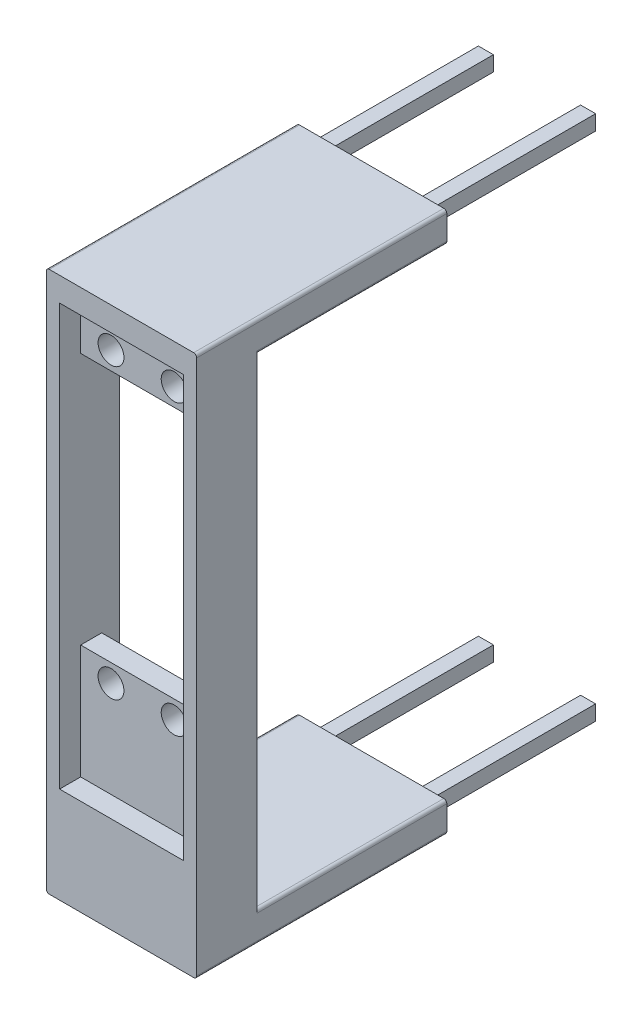
from build123d import *

# Parameters (mm, degrees)
BOSS_EXTRUDE1_OUTLINE_W   = 25
BOSS_EXTRUDE1_OUTLINE_H   = 5
BOSS_EXTRUDE1_OUTLINE_W_2 = 3
BOSS_EXTRUDE1_OUTLINE_H_2 = 3
BOSS_EXTRUDE1_DEPTH       = 31.595565731
SKETCH4_W                 = 25
SKETCH4_H                 = 90
BOSS_EXTRUDE3_DEPTH       = 10
SKETCH6_R                 = 2.15
CUT_EXTRUDE2_DEPTH        = 10
SKETCH7_W                 = 20.6
SKETCH7_H                 = 42
CUT_EXTRUDE3_DEPTH        = 10
SKETCH9_W                 = 2
SKETCH9_H                 = 90
CUT_EXTRUDE4_DEPTH        = 105.890618955
SKETCH10_W                = 2
SKETCH10_H                = 90
BOSS_EXTRUDE4_DEPTH       = 25
SKETCH8_W                 = 2.5
SKETCH8_H                 = 2.5
BOSS_EXTRUDE5_DEPTH       = 27.5
SKETCH11_W                = 3
SKETCH11_H                = 80
CUT_EXTRUDE5_DEPTH        = 123.742049491
SKETCH13_W                = 20.6
SKETCH13_H                = 57
CUT_EXTRUDE6_DEPTH        = 3
FILLET1_R                 = 0.5
SKETCH14_W                = 20.6
SKETCH14_H                = 70
CUT_EXTRUDE7_DEPTH        = 3.5


# Read off the part's stored shape, not the designer's step: Boss-Extrude1
with BuildPart() as part:
    # Boss-Extrude1 outline → Boss-Extrude1 (new body)
    # profile 1 of 2: a face of its own
    with BuildSketch(Plane.XY.offset(-60.133068515)):
        with Locations((125.570893714, 79.725640866)):
            Rectangle(BOSS_EXTRUDE1_OUTLINE_W, BOSS_EXTRUDE1_OUTLINE_H)
        with Locations((117.070893714, 79.725640866)):
            Rectangle(BOSS_EXTRUDE1_OUTLINE_W_2, BOSS_EXTRUDE1_OUTLINE_H_2, mode=Mode.SUBTRACT)
        with Locations((134.070893714, 79.725640866)):
            Rectangle(BOSS_EXTRUDE1_OUTLINE_W_2, BOSS_EXTRUDE1_OUTLINE_H_2, mode=Mode.SUBTRACT)
    # profile 2 of 2: a face of its own
    with BuildSketch(Plane.XY.offset(-60.133068515)):
        with Locations((125.570893714, -5.274359134)):
            Rectangle(BOSS_EXTRUDE1_OUTLINE_W, BOSS_EXTRUDE1_OUTLINE_H)
        with Locations((117.070893714, -5.274359134)):
            Rectangle(BOSS_EXTRUDE1_OUTLINE_W_2, BOSS_EXTRUDE1_OUTLINE_H_2, mode=Mode.SUBTRACT)
        with Locations((134.070893714, -5.274359134)):
            Rectangle(BOSS_EXTRUDE1_OUTLINE_W_2, BOSS_EXTRUDE1_OUTLINE_H_2, mode=Mode.SUBTRACT)
    extrude(amount=BOSS_EXTRUDE1_DEPTH)

    # Sketch4 → Boss-Extrude3 (add)
    with BuildSketch(Plane.XY.offset(-28.537502783)):
        with Locations((125.570893714, 37.225640866)):
            Rectangle(SKETCH4_W, SKETCH4_H)
    extrude(amount=BOSS_EXTRUDE3_DEPTH)

    # Sketch6 → Cut-Extrude2 (cut)
    with BuildSketch(Plane.XY.offset(-18.537502783)):
        with Locations((130.820893714, 24.225640866)):
            Circle(SKETCH6_R)
        with Locations((120.320893714, 24.225640866)):
            Circle(SKETCH6_R)
        with Locations((130.820893714, 72.225640866)):
            Circle(SKETCH6_R)
        with Locations((120.320893714, 72.225640866)):
            Circle(SKETCH6_R)
        with Locations((130.820893714, 72.225640866)):
            Circle(SKETCH6_R)
    extrude(amount=-CUT_EXTRUDE2_DEPTH, mode=Mode.SUBTRACT)

    # Sketch7 → Cut-Extrude3 (cut)
    with BuildSketch(Plane.XY.offset(-18.537502783)):
        with Locations((125.570893714, 48.225640866)):
            Rectangle(SKETCH7_W, SKETCH7_H)
    extrude(amount=-CUT_EXTRUDE3_DEPTH, mode=Mode.SUBTRACT)

    # Sketch9 → Cut-Extrude4 (cut, through all)
    with BuildSketch(Plane(origin=(138.070893714, 0, 0), x_dir=(0, 0, -1), z_dir=(1, 0, 0))):
        with Locations((59.133068515, 37.225640866)):
            Rectangle(SKETCH9_W, SKETCH9_H)
    extrude(amount=-CUT_EXTRUDE4_DEPTH, mode=Mode.SUBTRACT)

    # Sketch10 → Boss-Extrude4 (add)
    with BuildSketch(Plane(origin=(138.070893714, 0, 0), x_dir=(0, 0, -1), z_dir=(1, 0, 0))):
        with Locations((59.133068515, 37.225640866)):
            Rectangle(SKETCH10_W, SKETCH10_H)
    extrude(amount=-BOSS_EXTRUDE4_DEPTH)

    # Sketch8 → Boss-Extrude5 (add)
    with BuildSketch(Plane(origin=(0, 0, -60.133068515), x_dir=(-1, 0, 0), z_dir=(0, 0, -1))):
        Polygon((-135.320893714, 80.975640866), (-135.320893714, 78.475640866), (-132.820893714, 78.475640866), align=None)
        Polygon((-132.820893714, 80.975640866), (-132.820893714, 78.475640866), (-135.320893714, 80.975640866), align=None)
        Polygon((-118.320893714, 80.975640866), (-118.320893714, 78.475640866), (-115.820893714, 80.975640866), align=None)
        Polygon((-118.320893714, 78.475640866), (-115.820893714, 80.975640866), (-115.820893714, 78.475640866), align=None)
        with Locations((-117.070893714, -5.274359134)):
            Rectangle(SKETCH8_W, SKETCH8_H)
        with Locations((-134.070893714, -5.274359134)):
            Rectangle(SKETCH8_W, SKETCH8_H)
    extrude(amount=BOSS_EXTRUDE5_DEPTH)

    # Sketch11 → Cut-Extrude5 (cut, through all)
    with BuildSketch(Plane(origin=(138.070893714, 0, 0), x_dir=(0, 0, -1), z_dir=(1, 0, 0))):
        with Locations((59.633068515, 37.225640866)):
            Rectangle(SKETCH11_W, SKETCH11_H)
    extrude(amount=-CUT_EXTRUDE5_DEPTH, mode=Mode.SUBTRACT)

    # Sketch13 → Cut-Extrude6 (cut)
    with BuildSketch(Plane(origin=(0, 0, -28.537502783), x_dir=(-1, 0, 0), z_dir=(0, 0, -1))):
        with Locations((-125.570893714, 46.975640866)):
            Rectangle(SKETCH13_W, SKETCH13_H)
    extrude(amount=-CUT_EXTRUDE6_DEPTH, mode=Mode.SUBTRACT)

    # Fillet1
    fillet1_edges = [part.edges().sort_by_distance(p)[0] for p in [
        (113.070893714, -7.774359134, -38.335285649),
        (138.070893714, -7.774359134, -43.335285649),
        (138.070893714, 77.225640866, -43.335285649),
        (138.070893714, 82.225640866, -39.335285649),
        (113.070893714, 82.225640866, -43.335285649),
        (138.070893714, -2.774359134, -43.335285649),
        (113.070893714, 77.225640866, -43.335285649),
        (113.070893714, -2.774359134, -43.335285649),
    ]]
    fillet(fillet1_edges, radius=FILLET1_R)

    # Sketch14 → Cut-Extrude7 (cut)
    with BuildSketch(Plane.XY.offset(-18.537502783)):
        with Locations((125.570893714, 43.225640866)):
            Rectangle(SKETCH14_W, SKETCH14_H)
    extrude(amount=-CUT_EXTRUDE7_DEPTH, mode=Mode.SUBTRACT)


solid = part.part
